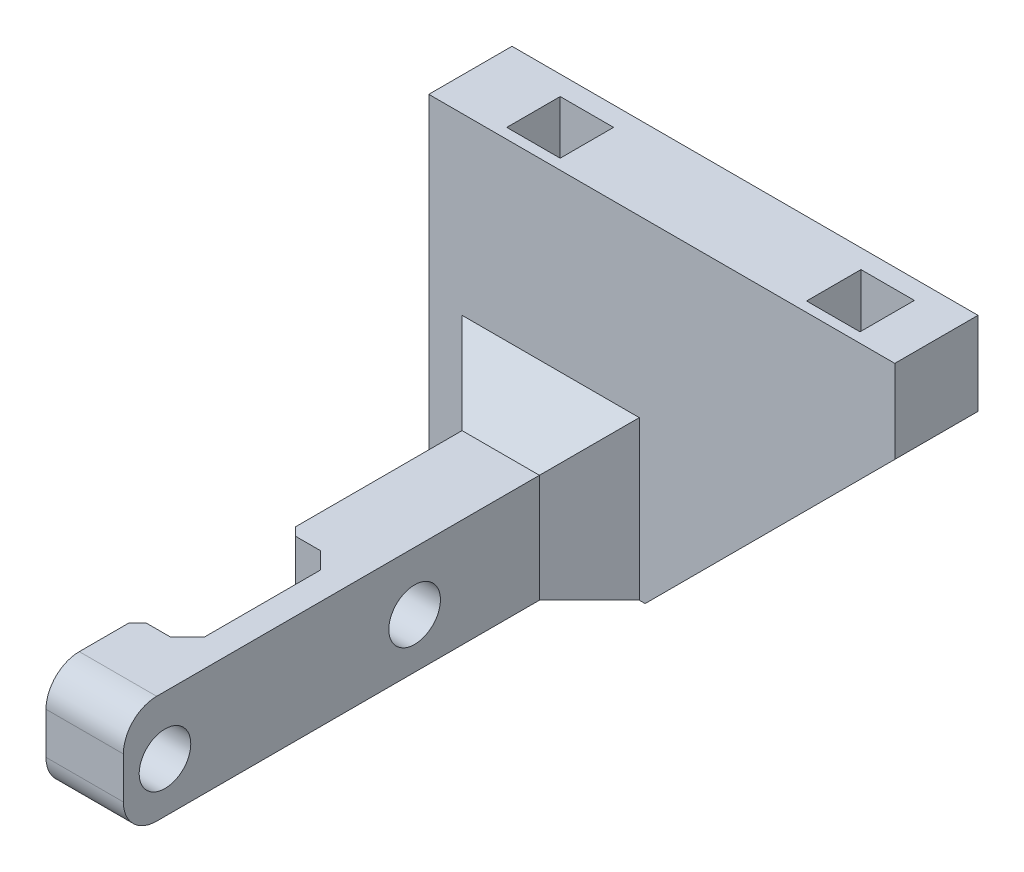
from build123d import *

# Parameters (mm, degrees)
SKETCH1_W           = 28
SKETCH1_H           = 5
BOSS_EXTRUDE1_DEPTH = 20
CHAMFER1_SIZE       = 15
BOSS_EXTRUDE2_DEPTH = 28
SKETCH3_W           = 3
SKETCH3_H           = 9
CUT_EXTRUDE1_DEPTH  = 12.8
CHAMFER2_SIZE       = 1
FILLET1_R           = 2
CHAMFER3_SIZE       = 0.5
CUT_EXTRUDE2_DEPTH  = 12.8
CHAMFER4_SIZE       = 3
CHAMFER5_SIZE       = 3
SKETCH8_W           = 3.209995615
SKETCH8_H           = 3.268000248
SKETCH8_W_2         = 3.20799886
SKETCH8_H_2         = 3.210000155
CUT_EXTRUDE3_DEPTH  = 5.4


with BuildPart() as part:
    # Sketch1 → Boss-Extrude1 (new body)
    with BuildSketch(Plane(origin=(0, 0, 0), x_dir=(1, 0, 0), z_dir=(0, 1, 0))):
        with Locations((14, 2.5)):
            Rectangle(SKETCH1_W, SKETCH1_H)
    extrude(amount=BOSS_EXTRUDE1_DEPTH)

    # Chamfer1
    chamfer1_edges = [part.edges().sort_by_distance(p)[0] for p in [
        (28, 0, -2.5),
    ]]
    chamfer(chamfer1_edges, length=CHAMFER1_SIZE)

    # Sketch2 → Boss-Extrude2 (add)
    with BuildSketch(Plane.XY):
        Polygon((9.648757297, 6.5), (5, 6.5), (5, 2), (5, 0), (9.648757297, 0), align=None)
    extrude(amount=BOSS_EXTRUDE2_DEPTH)

    # Sketch3 → Cut-Extrude1 (cut)
    with BuildSketch(Plane.XZ):
        with Locations((6.5, 18)):
            Rectangle(SKETCH3_W, SKETCH3_H)
    extrude(amount=-CUT_EXTRUDE1_DEPTH, mode=Mode.SUBTRACT)

    # Chamfer2
    chamfer2_edges = [part.edges().sort_by_distance(p)[0] for p in [
        (8, 3.25, 13.5),
        (8, 3.25, 22.5),
    ]]
    chamfer(chamfer2_edges, length=CHAMFER2_SIZE)

    # Fillet1
    fillet1_edges = [part.edges().sort_by_distance(p)[0] for p in [
        (7.324378649, 6.5, 28),
        (7.324378649, 0, 28),
    ]]
    fillet(fillet1_edges, radius=FILLET1_R)

    # Chamfer3
    chamfer3_edges = [part.edges().sort_by_distance(p)[0] for p in [
        (5, 3.25, 22.5),
        (5, 3.25, 13.5),
    ]]
    chamfer(chamfer3_edges, length=CHAMFER3_SIZE)

    # Sketch4 → Cut-Extrude2 (cut)
    with BuildSketch(Plane.ZY.offset(-5)):
        with BuildLine():
            ThreePointArc((25.5, 1.45), (27.05, 3), (25.5, 4.55))
            ThreePointArc((25.5, 4.55), (23.95, 3), (25.5, 1.45))
        make_face()
        with BuildLine():
            ThreePointArc((10.5, 4.55), (8.95, 3), (10.5, 1.45))
            ThreePointArc((10.5, 1.45), (12.05, 3), (10.5, 4.55))
        make_face()
    extrude(amount=-CUT_EXTRUDE2_DEPTH, mode=Mode.SUBTRACT)

    # Chamfer4
    chamfer4_edges = [part.edges().sort_by_distance(p)[0] for p in [
        (5, 3.25, 0),
        (9.648757297, 3.25, 0),
    ]]
    chamfer(chamfer4_edges, length=CHAMFER4_SIZE)

    # Chamfer5
    chamfer5_edges = [part.edges().sort_by_distance(p)[0] for p in [
        (7.324378649, 6.5, 0),
    ]]
    chamfer(chamfer5_edges, length=CHAMFER5_SIZE)

    # Sketch8 → Cut-Extrude3 (cut)
    with BuildSketch(Plane(origin=(0, 20, 0), x_dir=(1, 0, 0), z_dir=(0, 1, 0))):
        with Locations((23.709002883, 2.229999751)):
            Rectangle(SKETCH8_W, SKETCH8_H)
        with Locations((5.668003112, 2.226999903)):
            Rectangle(SKETCH8_W_2, SKETCH8_H_2)
    extrude(amount=-CUT_EXTRUDE3_DEPTH, mode=Mode.SUBTRACT)


solid = part.part
